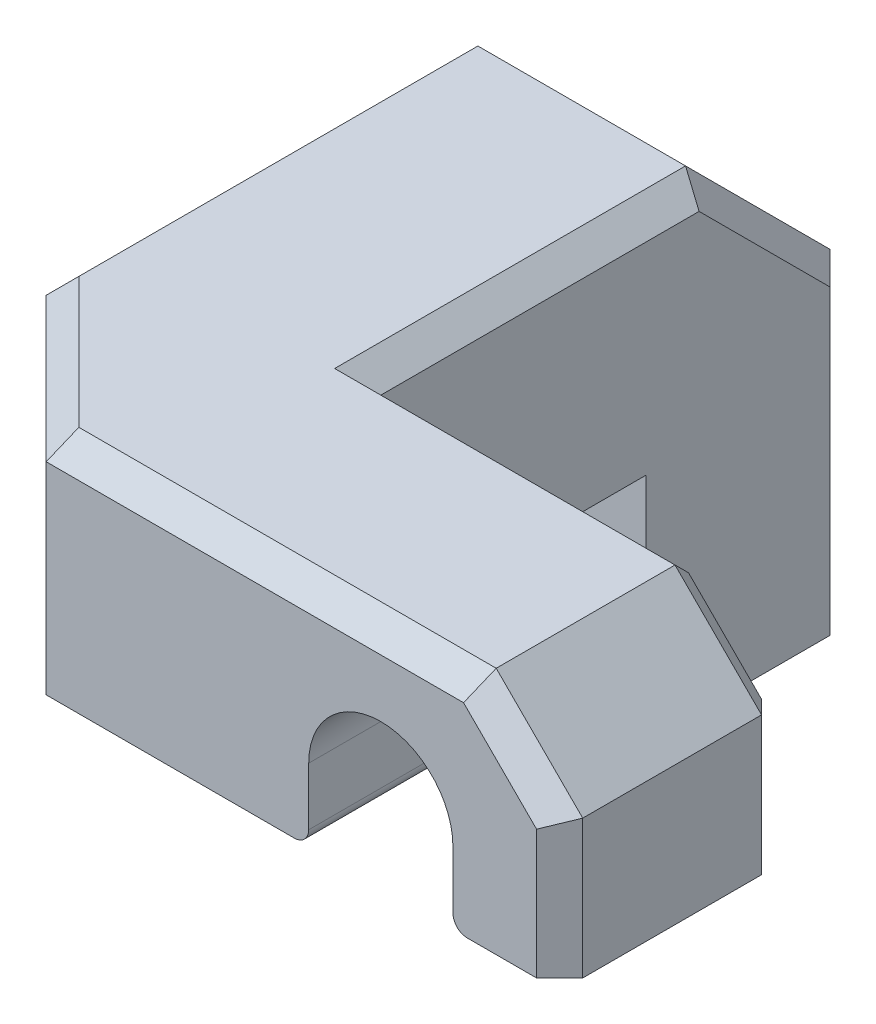
from build123d import *

# Parameters (mm, degrees)
BOSS_EXTRUDE1_DEPTH = 11.176
SKETCH2_W           = 9.906
SKETCH2_H           = 9.906
BOSS_EXTRUDE2_DEPTH = 17.78
CUT_EXTRUDE1_REACH  = 43.411
SKETCH3_R           = 3.175
CUT_EXTRUDE2_REACH  = 49.167
SKETCH4_R           = 1.778
SKETCH5_R           = 2.921
CUT_EXTRUDE3_DEPTH  = 3.556
FILLET8_R           = 0.635
CHAMFER1_SIZE       = 6.35
CHAMFER2_SIZE       = 6.35
CHAMFER3_SIZE       = 3.81
CHAMFER4_SIZE       = 1.016
CHAMFER5_SIZE       = 1.016


# Read off the part's stored shape, not the designer's step: Boss-Extrude1
with BuildPart() as part:
    # Boss-Extrude1 outline → Boss-Extrude1 (new body)
    with BuildSketch(Plane(origin=(0, 0, 0), x_dir=(0, 0, -1), z_dir=(1, 0, 0))):
        Polygon((9.099769579, 0.0001), (9.099769579, 21.082), (-21.59, 21.082), (-21.59, 11.176), (0, 11.176), (0, 0.0001), align=None)
    extrude(amount=BOSS_EXTRUDE1_DEPTH)

    # Sketch2 → Boss-Extrude2 (add)
    with BuildSketch(Plane(origin=(11.176, 0, 0), x_dir=(0, 0, -1), z_dir=(1, 0, 0))):
        with Locations((-16.637, 16.129)):
            Rectangle(SKETCH2_W, SKETCH2_H)
    extrude(amount=BOSS_EXTRUDE2_DEPTH)

    # Sketch3 → Cut-Extrude1 (cut, up to next)
    with BuildSketch(Plane(origin=(0, 0, 11.684), x_dir=(-1, 0, 0), z_dir=(0, 0, -1)), mode=Mode.PRIVATE) as cut_extrude1_sk1:
        with Locations((-21.082, 14.351)):
            Circle(SKETCH3_R)
    cut_extrude1_tool1 = extrude(cut_extrude1_sk1.sketch, amount=-CUT_EXTRUDE1_REACH, mode=Mode.PRIVATE) & part.part
    # Sketch3 → Cut-Extrude1 (cut, up to next)
    with BuildSketch(Plane(origin=(0, 0, 11.684), x_dir=(-1, 0, 0), z_dir=(0, 0, -1)), mode=Mode.PRIVATE) as cut_extrude1_sk2:
        with BuildLine():
            ThreePointArc((-21.082, 11.176), (-23.32706403, 12.10593597), (-24.257, 14.351))
            Line((-24.257, 14.351), (-24.257, 11.176))
            Line((-24.257, 11.176), (-21.082, 11.176))
        make_face()
    cut_extrude1_tool2 = extrude(cut_extrude1_sk2.sketch, amount=-CUT_EXTRUDE1_REACH, mode=Mode.PRIVATE) & part.part
    # Sketch3 → Cut-Extrude1 (cut, up to next)
    with BuildSketch(Plane(origin=(0, 0, 11.684), x_dir=(-1, 0, 0), z_dir=(0, 0, -1)), mode=Mode.PRIVATE) as cut_extrude1_sk3:
        with BuildLine():
            Line((-17.907, 11.176), (-17.907, 14.351))
            ThreePointArc((-17.907, 14.351), (-18.83693597, 12.10593597), (-21.082, 11.176))
            Line((-21.082, 11.176), (-17.907, 11.176))
        make_face()
    cut_extrude1_tool3 = extrude(cut_extrude1_sk3.sketch, amount=-CUT_EXTRUDE1_REACH, mode=Mode.PRIVATE) & part.part
    add(cut_extrude1_tool1.solids().sort_by_distance((21.082, 14.351, 11.684))[0], mode=Mode.SUBTRACT)
    add(cut_extrude1_tool2.solids().sort_by_distance((23.547807, 11.885193, 11.684))[0], mode=Mode.SUBTRACT)
    add(cut_extrude1_tool3.solids().sort_by_distance((18.616193, 11.885193, 11.684))[0], mode=Mode.SUBTRACT)

    # Sketch4 → Cut-Extrude2 (cut, up to next)
    with BuildSketch(Plane(origin=(0, 0, -9.099769579), x_dir=(-1, 0, 0), z_dir=(0, 0, -1)), mode=Mode.PRIVATE) as cut_extrude2_sk1:
        with Locations((-5.588, 5.5881)):
            Circle(SKETCH4_R)
    cut_extrude2_tool1 = extrude(cut_extrude2_sk1.sketch, amount=-CUT_EXTRUDE2_REACH, mode=Mode.PRIVATE) & part.part
    add(cut_extrude2_tool1.solids().sort_by_distance((5.588, 5.5881, -9.09977))[0], mode=Mode.SUBTRACT)

    # Sketch5 → Cut-Extrude3 (cut)
    with BuildSketch(Plane(origin=(0, 0, -9.099769579), x_dir=(-1, 0, 0), z_dir=(0, 0, -1))):
        with Locations((-5.588, 5.5881)):
            Circle(SKETCH5_R)
    extrude(amount=-CUT_EXTRUDE3_DEPTH, mode=Mode.SUBTRACT)

    # Fillet8
    fillet8_edges = [part.edges().sort_by_distance(p)[0] for p in [
        (24.257, 11.176, 16.637),
        (17.907, 11.176, 16.637),
    ]]
    fillet(fillet8_edges, radius=FILLET8_R)

    # Chamfer1
    chamfer1_edges = [part.edges().sort_by_distance(p)[0] for p in [
        (5.588, 21.082, -9.099769579),
    ]]
    chamfer(chamfer1_edges, length=CHAMFER1_SIZE)

    # Chamfer2
    chamfer2_edges = [part.edges().sort_by_distance(p)[0] for p in [
        (0, 16.129, 21.59),
    ]]
    chamfer(chamfer2_edges, length=CHAMFER2_SIZE)

    # Chamfer3
    chamfer3_edges = [part.edges().sort_by_distance(p)[0] for p in [
        (28.956, 21.082, 16.637),
    ]]
    chamfer(chamfer3_edges, length=CHAMFER3_SIZE)

    # Chamfer4
    chamfer4_edges = [part.edges().sort_by_distance(p)[0] for p in [
        (28.956, 14.224, 21.59),
        (27.051, 19.177, 21.59),
        (15.748, 21.082, 21.59),
        (28.956, 14.224, 11.684),
        (27.051, 19.177, 11.684),
        (18.161, 21.082, 11.684),
        (11.176, 21.082, 4.46711521),
        (11.176, 17.907, -5.924769579),
        (0, 21.082, 6.24511521),
        (0, 17.907, -5.924769579),
        (0, 7.36605, -9.099769579),
        (11.176, 7.36605, -9.099769579),
        (0, 0.0001, -4.54988479),
        (5.588, 0.0001, -9.099769579),
        (11.176, 0.0001, -4.54988479),
    ]]
    chamfer(chamfer4_edges, length=CHAMFER4_SIZE)

    # Chamfer5
    chamfer5_edges = [part.edges().sort_by_distance(p)[0] for p in [
        (3.175, 21.082, 18.415),
    ]]
    chamfer(chamfer5_edges, length=CHAMFER5_SIZE)


solid = part.part
